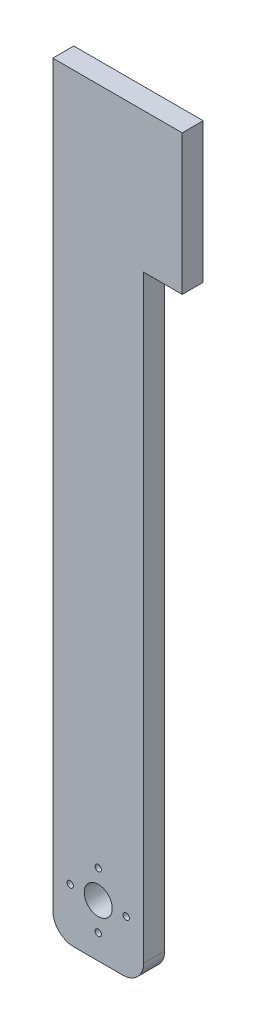
from build123d import *

# Parameters (mm, degrees)
ESQUISSE1_R        = 0.9
ESQUISSE1_R_2      = 4
BOSS_EXTRU_1_DEPTH = 6


with BuildPart() as part:
    # Esquisse1 → Boss.-Extru.1 (new body)
    with BuildSketch(Plane.XY):
        with BuildLine():
            Line((24.916434397, -77.573457495), (24.916434397, 93.426542505))
            Line((24.916434397, 93.426542505), (24.916434397, 133.426542505))
            Line((24.916434397, 133.426542505), (50.916434397, 133.426542505))
            Line((50.916434397, 133.426542505), (61.916434397, 133.426542505))
            Line((61.916434397, 133.426542505), (61.916434397, 93.426542505))
            Line((61.916434397, 93.426542505), (50.916434397, 93.426542505))
            Line((50.916434397, 93.426542505), (50.916434397, -77.573457495))
            ThreePointArc((50.916434397, -77.573457495), (49.159075085, -81.816098182), (44.916434397, -83.573457495))
            Line((44.916434397, -83.573457495), (30.916434397, -83.573457495))
            ThreePointArc((30.916434397, -83.573457495), (26.67379371, -81.816098182), (24.916434397, -77.573457495))
        make_face()
        with Locations((29.916434397, -68.573457495)):
            Circle(ESQUISSE1_R, mode=Mode.SUBTRACT)
        with Locations((37.916434397, -60.573457495)):
            Circle(ESQUISSE1_R, mode=Mode.SUBTRACT)
        with Locations((45.916434397, -68.573457495)):
            Circle(ESQUISSE1_R, mode=Mode.SUBTRACT)
        with Locations((37.916434397, -76.573457495)):
            Circle(ESQUISSE1_R, mode=Mode.SUBTRACT)
        with Locations((37.916434397, -68.573457495)):
            Circle(ESQUISSE1_R_2, mode=Mode.SUBTRACT)
    extrude(amount=BOSS_EXTRU_1_DEPTH)


solid = part.part
